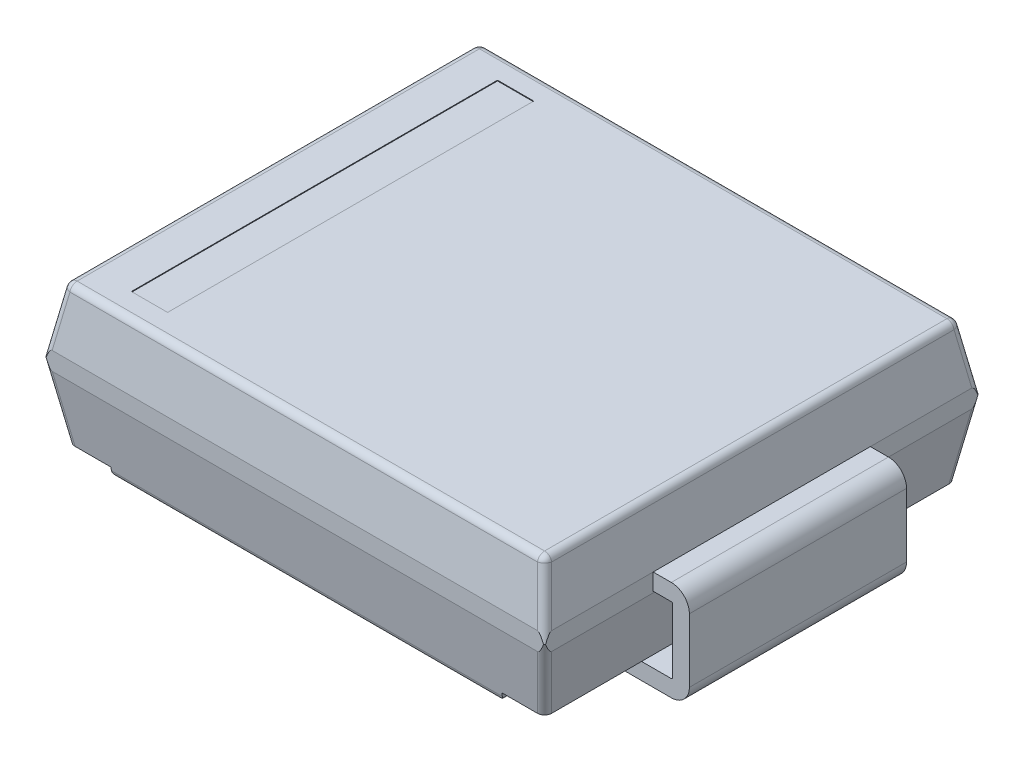
from build123d import *

# Parameters (mm, degrees)
EXTRUDE2_DEPTH  = 3
EXTRUDE10_DEPTH = 5.687050188
EXTRUDE6_DEPTH  = 1.5
FILLET1_R       = 0.1
SKETCH17_W      = 0.5
SKETCH17_H      = 5.057109984
EXTRUDE11_DEPTH = 0.01


with BuildPart() as part:
    # Sketch5 → Extrude2 (new, symmetric)
    with BuildSketch(Plane.XY):
        Polygon((-3.45, 0.252443442), (-3.45, 0.002443442), (-3.291571563, -0.896048874), (-2.7, -0.896048874), (-2.7, -1.027556558), (2.7, -1.027556558), (2.7, -0.896048874), (3.291571563, -0.896048874), (3.45, 0.002443442), (3.45, 0.252443442), (3.312464955, 1.032443442), (-3.312464955, 1.032443442), align=None)
    extrude(amount=EXTRUDE2_DEPTH, both=True)

    # Sketch15 → Extrude10 (cut, symmetric)
    with BuildSketch(Plane(origin=(0, 0, 0), x_dir=(0, 0, -1), z_dir=(1, 0, 0))):
        Polygon((-1.365649055, -24.756382672), (2.66841867, -1.878047724), (3, 0.002443442), (3, 0.252443442), (2.606426498, 2.484509687), (-1.427641227, 25.362844635), (45.034863515, 25.420313828), (45.096855687, -24.698913478), align=None)
    extrude10 = extrude(amount=EXTRUDE10_DEPTH, both=True, mode=Mode.SUBTRACT)

    # Mirror1: Extrude10 across plane
    add(extrude10.mirror(Plane.XY), mode=Mode.SUBTRACT)

    # Sketch9 → Extrude6 (add, symmetric)
    with BuildSketch(Plane.XY):
        with BuildLine():
            Line((-3.45, 0.252443442), (-3.7, 0.252443442))
            ThreePointArc((-3.7, 0.252443442), (-3.876776695, 0.179220137), (-3.95, 0.002443442))
            Line((-3.95, 0.002443442), (-3.95, -0.877556558))
            ThreePointArc((-3.95, -0.877556558), (-3.876776695, -1.054333254), (-3.7, -1.127556558))
            Line((-3.7, -1.127556558), (-2.8, -1.127556558))
            Line((-2.8, -1.127556558), (-2.8, -0.897556558))
            Line((-2.8, -0.897556558), (-3.7, -0.897556558))
            ThreePointArc((-3.7, -0.897556558), (-3.714142136, -0.891698694), (-3.72, -0.877556558))
            Line((-3.72, -0.877556558), (-3.72, 0.002443442))
            ThreePointArc((-3.72, 0.002443442), (-3.714142136, 0.016585577), (-3.7, 0.022443442))
            Line((-3.7, 0.022443442), (-3.45, 0.022443442))
            Line((-3.45, 0.022443442), (-3.45, 0.252443442))
        make_face()
        with BuildLine():
            Line((3.45, 0.252443442), (3.45, 0.022443442))
            Line((3.45, 0.022443442), (3.7, 0.022443442))
            ThreePointArc((3.7, 0.022443442), (3.714142136, 0.016585577), (3.72, 0.002443442))
            Line((3.72, 0.002443442), (3.72, -0.877556558))
            ThreePointArc((3.72, -0.877556558), (3.714142136, -0.891698694), (3.7, -0.897556558))
            Line((3.7, -0.897556558), (2.8, -0.897556558))
            Line((2.8, -0.897556558), (2.8, -1.127556558))
            Line((2.8, -1.127556558), (3.7, -1.127556558))
            ThreePointArc((3.7, -1.127556558), (3.876776695, -1.054333254), (3.95, -0.877556558))
            Line((3.95, -0.877556558), (3.95, 0.002443442))
            ThreePointArc((3.95, 0.002443442), (3.876776695, 0.179220137), (3.7, 0.252443442))
            Line((3.7, 0.252443442), (3.45, 0.252443442))
        make_face()
    extrude(amount=EXTRUDE6_DEPTH, both=True)

    # Fillet1
    # the kernel refuses this fillet: 0.1 mm, written as the material it takes off along each edge
    with BuildSketch(Plane(origin=(-3.228554992, 0.932443442, 2.778554992), x_dir=(-0.707106781186547, 0, -0.707106781186548), z_dir=(-0.508220601732601, 0.6952867321825629, 0.5082206017326002))) as fillet1_piece_1_section:
        Polygon((-0.186219601, -0.186219601), (0.186219601, -0.186219601), (0.186219601, 0.186219601), (-0.186219601, 0.186219601), align=None)
    fillet1_piece_1 = extrude(amount=0.186219601, mode=Mode.PRIVATE)
    fillet1_piece_1 = split(fillet1_piece_1, bisect_by=Plane(origin=(-3.228554992, 0.932443442, 2.778554992), z_dir=(0, 0, 1)), keep=Keep.TOP, mode=Mode.PRIVATE)
    fillet1_piece_1 = split(fillet1_piece_1, bisect_by=Plane(origin=(-3.228554992, 0.932443442, 2.778554992), z_dir=(0.17108786974602874, 0.9702875252478149, -0.1710878697460364)), keep=Keep.TOP, mode=Mode.PRIVATE)
    fillet1_piece_1 = split(fillet1_piece_1, bisect_by=Plane(origin=(-3.228554992, 0.932443442, 2.778554992), z_dir=(-1, 0, 0)), keep=Keep.TOP, mode=Mode.PRIVATE)
    fillet1_piece_1 = split(fillet1_piece_1, bisect_by=Plane(origin=(-3.228554992, 1.032443442, 2.778554992), z_dir=(0, -1, 0)), keep=Keep.TOP, mode=Mode.PRIVATE)
    fillet1_piece_1 = split(fillet1_piece_1, bisect_by=Plane(origin=(-3.327035767, 0.94980826, 2.778554992), z_dir=(0.9848077530122094, -0.17364817766692353, 0)), keep=Keep.TOP, mode=Mode.PRIVATE)
    fillet1_piece_1 = split(fillet1_piece_1, bisect_by=Plane(origin=(-3.228554992, 0.94980826, 2.877035767), z_dir=(0, -0.17364817766693108, -0.984807753012208)), keep=Keep.TOP, mode=Mode.PRIVATE)
    fillet1_piece_1 = fillet1_piece_1 - Plane(origin=(-3.228554992, 0.932443442, 2.778554992), x_dir=(0.508220601732601, -0.6952867321825629, -0.5082206017326002), z_dir=(-0.707106781186547, 0, -0.707106781186548)) * Sphere(FILLET1_R, mode=Mode.PRIVATE)
    add(fillet1_piece_1, mode=Mode.SUBTRACT)
    with BuildSketch(Plane(origin=(-3.228554992, 0.932443442, -2.778554992), x_dir=(0.707106781186547, 0, -0.707106781186548), z_dir=(-0.508220601732601, 0.6952867321825629, -0.5082206017326002))) as fillet1_piece_2_section:
        Polygon((-0.186219601, -0.186219601), (0.186219601, -0.186219601), (0.186219601, 0.186219601), (-0.186219601, 0.186219601), align=None)
    fillet1_piece_2 = extrude(amount=0.186219601, mode=Mode.PRIVATE)
    fillet1_piece_2 = split(fillet1_piece_2, bisect_by=Plane(origin=(-3.228554992, 0.932443442, -2.778554992), z_dir=(0, 0, -1)), keep=Keep.TOP, mode=Mode.PRIVATE)
    fillet1_piece_2 = split(fillet1_piece_2, bisect_by=Plane(origin=(-3.228554992, 0.932443442, -2.778554992), z_dir=(0.17108786974602874, 0.9702875252478149, 0.1710878697460364)), keep=Keep.TOP, mode=Mode.PRIVATE)
    fillet1_piece_2 = split(fillet1_piece_2, bisect_by=Plane(origin=(-3.228554992, 0.932443442, -2.778554992), z_dir=(-1, 0, 0)), keep=Keep.TOP, mode=Mode.PRIVATE)
    fillet1_piece_2 = split(fillet1_piece_2, bisect_by=Plane(origin=(-3.228554992, 1.032443442, -2.778554992), z_dir=(0, -1, 0)), keep=Keep.TOP, mode=Mode.PRIVATE)
    fillet1_piece_2 = split(fillet1_piece_2, bisect_by=Plane(origin=(-3.327035767, 0.94980826, -2.778554992), z_dir=(0.9848077530122094, -0.17364817766692353, 0)), keep=Keep.TOP, mode=Mode.PRIVATE)
    fillet1_piece_2 = split(fillet1_piece_2, bisect_by=Plane(origin=(-3.228554992, 0.94980826, -2.877035767), z_dir=(0, -0.17364817766693108, 0.984807753012208)), keep=Keep.TOP, mode=Mode.PRIVATE)
    fillet1_piece_2 = fillet1_piece_2 - Plane(origin=(-3.228554992, 0.932443442, -2.778554992), x_dir=(0.508220601732601, -0.6952867321825629, 0.5082206017326002), z_dir=(0.707106781186547, 0, -0.707106781186548)) * Sphere(FILLET1_R, mode=Mode.PRIVATE)
    add(fillet1_piece_2, mode=Mode.SUBTRACT)
    with BuildSketch(Plane(origin=(3.228554992, 0.932443442, -2.778554992), x_dir=(0.707106781186547, 0, 0.707106781186548), z_dir=(0.508220601732601, 0.6952867321825628, -0.5082206017326003))) as fillet1_piece_3_section:
        Polygon((-0.186219601, -0.186219601), (0.186219601, -0.186219601), (0.186219601, 0.186219601), (-0.186219601, 0.186219601), align=None)
    fillet1_piece_3 = extrude(amount=0.186219601, mode=Mode.PRIVATE)
    fillet1_piece_3 = split(fillet1_piece_3, bisect_by=Plane(origin=(3.228554992, 0.932443442, -2.778554992), z_dir=(0, 0, -1)), keep=Keep.TOP, mode=Mode.PRIVATE)
    fillet1_piece_3 = split(fillet1_piece_3, bisect_by=Plane(origin=(3.228554992, 0.932443442, -2.778554992), z_dir=(-0.17108786974602816, 0.970287525247815, 0.17108786974603643)), keep=Keep.TOP, mode=Mode.PRIVATE)
    fillet1_piece_3 = split(fillet1_piece_3, bisect_by=Plane(origin=(3.228554992, 0.932443442, -2.778554992), z_dir=(1, 0, 0)), keep=Keep.TOP, mode=Mode.PRIVATE)
    fillet1_piece_3 = split(fillet1_piece_3, bisect_by=Plane(origin=(3.228554992, 1.032443442, -2.778554992), z_dir=(0, -1, 0)), keep=Keep.TOP, mode=Mode.PRIVATE)
    fillet1_piece_3 = split(fillet1_piece_3, bisect_by=Plane(origin=(3.327035767, 0.94980826, -2.778554992), z_dir=(-0.9848077530122094, -0.17364817766692292, 0)), keep=Keep.TOP, mode=Mode.PRIVATE)
    fillet1_piece_3 = split(fillet1_piece_3, bisect_by=Plane(origin=(3.228554992, 0.94980826, -2.877035767), z_dir=(0, -0.17364817766693108, 0.984807753012208)), keep=Keep.TOP, mode=Mode.PRIVATE)
    fillet1_piece_3 = fillet1_piece_3 - Plane(origin=(3.228554992, 0.932443442, -2.778554992), x_dir=(-0.508220601732601, -0.6952867321825628, 0.5082206017326003), z_dir=(0.707106781186547, 0, 0.707106781186548)) * Sphere(FILLET1_R, mode=Mode.PRIVATE)
    add(fillet1_piece_3, mode=Mode.SUBTRACT)
    with BuildSketch(Plane(origin=(3.228554992, 0.932443442, 2.778554992), x_dir=(-0.707106781186547, 0, 0.707106781186548), z_dir=(0.508220601732601, 0.6952867321825628, 0.5082206017326003))) as fillet1_piece_4_section:
        Polygon((-0.186219601, -0.186219601), (0.186219601, -0.186219601), (0.186219601, 0.186219601), (-0.186219601, 0.186219601), align=None)
    fillet1_piece_4 = extrude(amount=0.186219601, mode=Mode.PRIVATE)
    fillet1_piece_4 = split(fillet1_piece_4, bisect_by=Plane(origin=(3.228554992, 0.932443442, 2.778554992), z_dir=(0, 0, 1)), keep=Keep.TOP, mode=Mode.PRIVATE)
    fillet1_piece_4 = split(fillet1_piece_4, bisect_by=Plane(origin=(3.228554992, 0.932443442, 2.778554992), z_dir=(-0.17108786974602816, 0.970287525247815, -0.17108786974603643)), keep=Keep.TOP, mode=Mode.PRIVATE)
    fillet1_piece_4 = split(fillet1_piece_4, bisect_by=Plane(origin=(3.228554992, 0.932443442, 2.778554992), z_dir=(1, 0, 0)), keep=Keep.TOP, mode=Mode.PRIVATE)
    fillet1_piece_4 = split(fillet1_piece_4, bisect_by=Plane(origin=(3.228554992, 1.032443442, 2.778554992), z_dir=(0, -1, 0)), keep=Keep.TOP, mode=Mode.PRIVATE)
    fillet1_piece_4 = split(fillet1_piece_4, bisect_by=Plane(origin=(3.327035767, 0.94980826, 2.778554992), z_dir=(-0.9848077530122094, -0.17364817766692292, 0)), keep=Keep.TOP, mode=Mode.PRIVATE)
    fillet1_piece_4 = split(fillet1_piece_4, bisect_by=Plane(origin=(3.228554992, 0.94980826, 2.877035767), z_dir=(0, -0.17364817766693108, -0.984807753012208)), keep=Keep.TOP, mode=Mode.PRIVATE)
    fillet1_piece_4 = fillet1_piece_4 - Plane(origin=(3.228554992, 0.932443442, 2.778554992), x_dir=(-0.508220601732601, -0.6952867321825628, -0.5082206017326003), z_dir=(-0.707106781186547, 0, 0.707106781186548)) * Sphere(FILLET1_R, mode=Mode.PRIVATE)
    add(fillet1_piece_4, mode=Mode.SUBTRACT)
    with BuildSketch(Plane(origin=(-2.909774908, -1.027556558, -2.81838321), x_dir=(0, 0.9848077530122077, -0.17364817766693205), z_dir=(1, 0, 0))) as fillet1_piece_5:
        with BuildLine():
            CenterArc((FILLET1_R * 0.839099631177, FILLET1_R), FILLET1_R, 190, 80)
            Line((-FILLET1_R * 0.145708121835, FILLET1_R * 0.826351822333), (0, 0))
            Line((0, 0), (FILLET1_R * 0.839099631177, 0))
        make_face()
    extrude(amount=5.819549816, mode=Mode.SUBTRACT)
    with BuildSketch(Plane(origin=(-2.7, -1.027556558, -3.06838321), x_dir=(0, 1, 0), z_dir=(0, 0, 1)), Plane(origin=(2.7, -1.027556558, -3.06838321), x_dir=(-1, 0, 0), z_dir=(0, 0, 1))) as fillet1_piece_6:
        with BuildLine():
            CenterArc((FILLET1_R, -FILLET1_R), FILLET1_R, 90, 90)
            Line((0, -FILLET1_R), (0, 0))
            Line((0, 0), (FILLET1_R, 0))
        make_face()
    extrude(amount=6.13676642, mode=Mode.SUBTRACT)
    with BuildSketch(Plane(origin=(-2.909774908, -1.027556558, 2.81838321), x_dir=(0, 0.9848077530122077, 0.17364817766693205), z_dir=(1, 0, 0))) as fillet1_piece_7:
        with BuildLine():
            CenterArc((FILLET1_R * 0.839099631177, -FILLET1_R), FILLET1_R, 90, 80)
            Line((-FILLET1_R * 0.145708121835, -FILLET1_R * 0.826351822333), (0, 0))
            Line((0, 0), (FILLET1_R * 0.839099631177, 0))
        make_face()
    extrude(amount=5.819549816, mode=Mode.SUBTRACT)
    with BuildSketch(Plane(origin=(-3.312464955, 1.032443442, 2.778554992), x_dir=(-0.17364817766692459, -0.9848077530122091, 0), z_dir=(0, 0, -1)), Plane(origin=(3.312464955, 1.032443442, 2.778554992), x_dir=(-1, 0, 0), z_dir=(0, 0, -1))) as fillet1_piece_8:
        with BuildLine():
            CenterArc((FILLET1_R * 0.839099631177, -FILLET1_R), FILLET1_R, 90, 80)
            Line((-FILLET1_R * 0.145708121835, -FILLET1_R * 0.826351822333), (0, 0))
            Line((0, 0), (FILLET1_R * 0.839099631177, 0))
        make_face()
    extrude(amount=5.557109984, mode=Mode.SUBTRACT)
    with BuildSketch(Plane(origin=(3.228554992, 1.032443442, -2.862464955), x_dir=(0, 0, 1), z_dir=(-1, 0, 0))) as fillet1_piece_9:
        with BuildLine():
            CenterArc((FILLET1_R * 0.839099631177, -FILLET1_R), FILLET1_R, 90, 80)
            Line((-FILLET1_R * 0.145708121835, -FILLET1_R * 0.826351822333), (0, 0))
            Line((0, 0), (FILLET1_R * 0.839099631177, 0))
        make_face()
    extrude(amount=6.457109984, mode=Mode.SUBTRACT)
    with BuildSketch(Plane(origin=(3.228554992, 1.032443442, 2.862464955), x_dir=(0, 0, -1), z_dir=(-1, 0, 0))) as fillet1_piece_10:
        with BuildLine():
            CenterArc((FILLET1_R * 0.839099631177, FILLET1_R), FILLET1_R, 190, 80)
            Line((-FILLET1_R * 0.145708121835, FILLET1_R * 0.826351822333), (0, 0))
            Line((0, 0), (FILLET1_R * 0.839099631177, 0))
        make_face()
    extrude(amount=6.457109984, mode=Mode.SUBTRACT)
    with BuildSketch(Plane(origin=(-3.574503319, 0.708536853, -3.124503319), x_dir=(-0.029709096802312214, 0.16848866057223963, 0.985255774317392), z_dir=(0.17108786974603277, -0.9702875252478144, 0.17108786974603588)), Plane(origin=(3.250070456, -1.131413344, 2.800070456), x_dir=(-0.9852557743173926, 0.1684886605722357, 0.029709096802311194), z_dir=(0.17108786974603182, 0.9702875252478146, 0.1710878697460359))) as fillet1_piece_11:
        with BuildLine():
            CenterArc((FILLET1_R * 0.970287525248, -FILLET1_R), FILLET1_R, 90, 88.272058928)
            Line((-FILLET1_R * 0.0292577488659, -FILLET1_R * 0.969846310393), (0, 0))
            Line((0, 0), (FILLET1_R * 0.970287525248, 0))
        make_face()
    extrude(amount=1.896293778, mode=Mode.SUBTRACT)
    with BuildSketch(Plane(origin=(-3.324153131, 0.966156504, -2.874153131), x_dir=(-0.029709096802307676, -0.16848866057224096, 0.9852557743173918), z_dir=(-0.17108786974602877, -0.970287525247815, -0.17108786974603643)), Plane(origin=(3.574503319, -0.453649969, 3.124503319), x_dir=(-0.9852557743173932, -0.16848866057223175, 0.02970909680231244), z_dir=(-0.17108786974602816, 0.970287525247815, -0.17108786974603643))) as fillet1_piece_12:
        with BuildLine():
            CenterArc((FILLET1_R * 0.970287525248, -FILLET1_R), FILLET1_R, 90, 88.272058928)
            Line((-FILLET1_R * 0.0292577488659, -FILLET1_R * 0.969846310393), (0, 0))
            Line((0, 0), (FILLET1_R * 0.970287525248, 0))
        make_face()
    extrude(amount=1.46328427, mode=Mode.SUBTRACT)
    with BuildSketch(Plane(origin=(-3.324153131, 0.966156504, 2.874153131), x_dir=(-0.029709096802303235, -0.16848866057224177, -0.9852557743173918), z_dir=(-0.17108786974602877, -0.970287525247815, 0.17108786974603643)), Plane(origin=(3.574503319, -0.453649969, -3.124503319), x_dir=(-0.9852557743173932, -0.16848866057223175, -0.02970909680231244), z_dir=(-0.17108786974602816, 0.970287525247815, 0.17108786974603643))) as fillet1_piece_13:
        with BuildLine():
            CenterArc((FILLET1_R * 0.970287525248, FILLET1_R), FILLET1_R, 181.727941072, 88.272058928)
            Line((-FILLET1_R * 0.0292577488659, FILLET1_R * 0.969846310393), (0, 0))
            Line((0, 0), (FILLET1_R * 0.970287525248, 0))
        make_face()
    extrude(amount=1.46328427, mode=Mode.SUBTRACT)
    with BuildSketch(Plane(origin=(-3.574503319, 0.708536853, 3.124503319), x_dir=(-0.029709096802312214, 0.16848866057223963, -0.985255774317392), z_dir=(0.17108786974603277, -0.9702875252478144, -0.17108786974603588)), Plane(origin=(3.250070456, -1.131413344, -2.800070456), x_dir=(-0.9852557743173926, 0.1684886605722357, -0.029709096802311194), z_dir=(0.17108786974603182, 0.9702875252478146, -0.1710878697460359))) as fillet1_piece_14:
        with BuildLine():
            CenterArc((FILLET1_R * 0.970287525248, FILLET1_R), FILLET1_R, 181.727941072, 88.272058928)
            Line((-FILLET1_R * 0.0292577488659, FILLET1_R * 0.969846310393), (0, 0))
            Line((0, 0), (FILLET1_R * 0.970287525248, 0))
        make_face()
    extrude(amount=1.896293778, mode=Mode.SUBTRACT)

    # Sketch17 → Extrude11 (cut)
    with BuildSketch(Plane(origin=(0, 1.032443442, 0), x_dir=(1, 0, 0), z_dir=(0, 1, 0))):
        with Locations((-2.478554992, 0)):
            Rectangle(SKETCH17_W, SKETCH17_H)
    extrude(amount=-EXTRUDE11_DEPTH, mode=Mode.SUBTRACT)


solid = part.part
